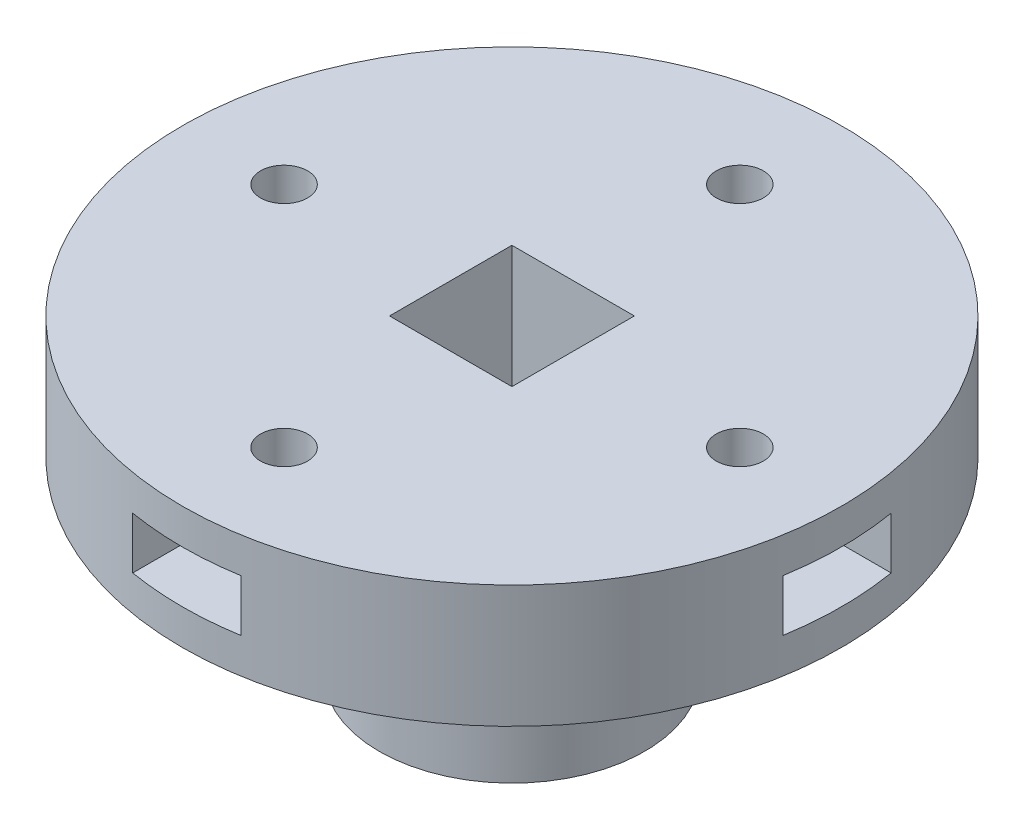
from build123d import *

# Parameters (mm, degrees)
SKETCH1_R               = 7.05
SKETCH1_W               = 6.5
SKETCH1_H               = 6.5
BOSS_EXTRUDE1_DEPTH     = 10
SKETCH2_R               = 17.5
BOSS_EXTRUDE2_DEPTH     = 6.5
CUT_EXTRUDE1_REACH      = 28.693
SKETCH3_R               = 1.25
CUT_EXTRUDE2_DEPTH      = 30.744747435
CUT_EXTRUDE2_DEPTH_BACK = 30.744747435
SKETCH4_R               = 1.5
CUT_EXTRUDE3_DEPTH      = 10
CUT_EXTRUDE3_DEPTH_BACK = 10
SKETCH6_W               = 6.5
SKETCH6_H               = 6.5
SKETCH8_W               = 5.75
SKETCH8_H               = 2.75
CUT_EXTRUDE4_DEPTH      = 5
CUT_EXTRUDE5_DEPTH      = 2.75
CIRPATTERN1_START       = 11.875
CIRPATTERN1_OUTLINE_R   = 1.25
CIRPATTERN1_DEPTH       = 2.75


# Read off the part's stored shape, not the designer's step: CirPattern1
with BuildPart() as part:
    # Sketch1 → Boss-Extrude1 (new body)
    with BuildSketch(Plane(origin=(0, 0, 0), x_dir=(1, 0, 0), z_dir=(0, 1, 0))):
        with Locations(Location((0, 0, 0), (0, 0, 270))):
            Circle(SKETCH1_R)
        Rectangle(SKETCH1_W, SKETCH1_H, mode=Mode.SUBTRACT)
    extrude(amount=BOSS_EXTRUDE1_DEPTH)

    # Sketch2 → Boss-Extrude2 (add)
    with BuildSketch(Plane(origin=(0, 10, 0), x_dir=(1, 0, 0), z_dir=(0, 1, 0))):
        with Locations(Location((0, 0, 0), (0, 0, 90))):
            Circle(SKETCH2_R)
    extrude(amount=BOSS_EXTRUDE2_DEPTH)

    # Sketch3 → Cut-Extrude1 (cut, up to next)
    with BuildSketch(Plane.XZ.offset(-10), mode=Mode.PRIVATE) as cut_extrude1_sk1:
        with Locations(Location((12.1, 0, 0), (0, 0, 270))):
            Circle(SKETCH3_R)
    cut_extrude1_tool1 = extrude(cut_extrude1_sk1.sketch, amount=-CUT_EXTRUDE1_REACH, mode=Mode.PRIVATE) & part.part
    # Sketch3 → Cut-Extrude1 (cut, up to next)
    with BuildSketch(Plane.XZ.offset(-10), mode=Mode.PRIVATE) as cut_extrude1_sk2:
        with Locations(Location((0, -12.1, 0), (0, 0, 270))):
            Circle(SKETCH3_R)
    cut_extrude1_tool2 = extrude(cut_extrude1_sk2.sketch, amount=-CUT_EXTRUDE1_REACH, mode=Mode.PRIVATE) & part.part
    # Sketch3 → Cut-Extrude1 (cut, up to next)
    with BuildSketch(Plane.XZ.offset(-10), mode=Mode.PRIVATE) as cut_extrude1_sk3:
        with Locations(Location((-12.1, 0, 0), (0, 0, 270))):
            Circle(SKETCH3_R)
    cut_extrude1_tool3 = extrude(cut_extrude1_sk3.sketch, amount=-CUT_EXTRUDE1_REACH, mode=Mode.PRIVATE) & part.part
    # Sketch3 → Cut-Extrude1 (cut, up to next)
    with BuildSketch(Plane.XZ.offset(-10), mode=Mode.PRIVATE) as cut_extrude1_sk4:
        with Locations(Location((0, 12.1, 0), (0, 0, 270))):
            Circle(SKETCH3_R)
    cut_extrude1_tool4 = extrude(cut_extrude1_sk4.sketch, amount=-CUT_EXTRUDE1_REACH, mode=Mode.PRIVATE) & part.part
    add(cut_extrude1_tool1.solids().sort_by_distance((12.1, 10, 0))[0], mode=Mode.SUBTRACT)
    add(cut_extrude1_tool2.solids().sort_by_distance((0, 10, -12.1))[0], mode=Mode.SUBTRACT)
    add(cut_extrude1_tool3.solids().sort_by_distance((-12.1, 10, 0))[0], mode=Mode.SUBTRACT)
    add(cut_extrude1_tool4.solids().sort_by_distance((0, 10, 12.1))[0], mode=Mode.SUBTRACT)

    # Sketch4 → Cut-Extrude2 (cut, two sides: drawn at the far end of the back side and taken through both)
    with BuildSketch(Plane.XY.offset(-CUT_EXTRUDE2_DEPTH_BACK)):
        with Locations((0, 4.916404418)):
            Circle(SKETCH4_R)
    extrude(amount=CUT_EXTRUDE2_DEPTH + CUT_EXTRUDE2_DEPTH_BACK, mode=Mode.SUBTRACT)

    # Sketch6 → Cut-Extrude3 (cut, two sides: drawn at the far end of the back side and taken through both)
    with BuildSketch(Plane(origin=(0, 10, 0), x_dir=(-1, 0, 0), z_dir=(0, -1, 0)).offset(-CUT_EXTRUDE3_DEPTH_BACK)):
        Rectangle(SKETCH6_W, SKETCH6_H)
    extrude(amount=CUT_EXTRUDE3_DEPTH + CUT_EXTRUDE3_DEPTH_BACK, mode=Mode.SUBTRACT)

    # Sketch8 → Cut-Extrude4 (cut)
    with BuildSketch(Plane(origin=(17.5, 0, 0), x_dir=(0, 0, -1), z_dir=(1, 0, 0))):
        with Locations((0, 13.25)):
            Rectangle(SKETCH8_W, SKETCH8_H)
    extrude(amount=-CUT_EXTRUDE4_DEPTH, mode=Mode.SUBTRACT)

    # Sketch9 → Cut-Extrude5 (cut)
    with BuildSketch(Plane.XZ.offset(-14.625)):
        Polygon((15.419764048, 0), (13.759882024, 2.875), (10.440117976, 2.875), (8.780235952, 0), (10.440117976, -2.875), (13.759882024, -2.875), align=None)
    extrude(amount=CUT_EXTRUDE5_DEPTH, mode=Mode.SUBTRACT)

    # CirPattern1 outline → CirPattern1 (cut)
    # profile 1 of 3: a face of its own
    with BuildSketch(Plane(origin=(0, 0, 0), x_dir=(1, 0, 0), z_dir=(0, 1, 0)).offset(CIRPATTERN1_START)):
        with BuildLine():
            Line((-8.780235952, 0), (-10.440117976, 2.875))
            Line((-10.440117976, 2.875), (-17.26222393, 2.875))
            ThreePointArc((-17.26222393, 2.875), (-17.5, 0), (-17.26222393, -2.875))
            Line((-17.26222393, -2.875), (-10.440117976, -2.875))
            Line((-10.440117976, -2.875), (-8.780235952, 0))
        make_face()
        with Locations((-12.1, 0)):
            Circle(CIRPATTERN1_OUTLINE_R, mode=Mode.SUBTRACT)
    # profile 2 of 3: a face of its own
    with BuildSketch(Plane(origin=(0, 0, 0), x_dir=(1, 0, 0), z_dir=(0, 1, 0)).offset(CIRPATTERN1_START)):
        with BuildLine():
            ThreePointArc((2.875, 17.26222393), (0, 17.5), (-2.875, 17.26222393))
            Line((-2.875, 17.26222393), (-2.875, 10.440117976))
            Line((-2.875, 10.440117976), (0, 8.780235952))
            Line((0, 8.780235952), (2.875, 10.440117976))
            Line((2.875, 10.440117976), (2.875, 17.26222393))
        make_face()
        with Locations((0, 12.1)):
            Circle(CIRPATTERN1_OUTLINE_R, mode=Mode.SUBTRACT)
    # profile 3 of 3: a face of its own
    with BuildSketch(Plane(origin=(0, 0, 0), x_dir=(1, 0, 0), z_dir=(0, 1, 0)).offset(CIRPATTERN1_START)):
        with BuildLine():
            Line((-2.875, -10.440117976), (-2.875, -17.26222393))
            ThreePointArc((-2.875, -17.26222393), (0, -17.5), (2.875, -17.26222393))
            Line((2.875, -17.26222393), (2.875, -10.440117976))
            Line((2.875, -10.440117976), (0, -8.780235952))
            Line((0, -8.780235952), (-2.875, -10.440117976))
        make_face()
        with Locations((0, -12.1)):
            Circle(CIRPATTERN1_OUTLINE_R, mode=Mode.SUBTRACT)
    extrude(amount=CIRPATTERN1_DEPTH, mode=Mode.SUBTRACT)


solid = part.part
